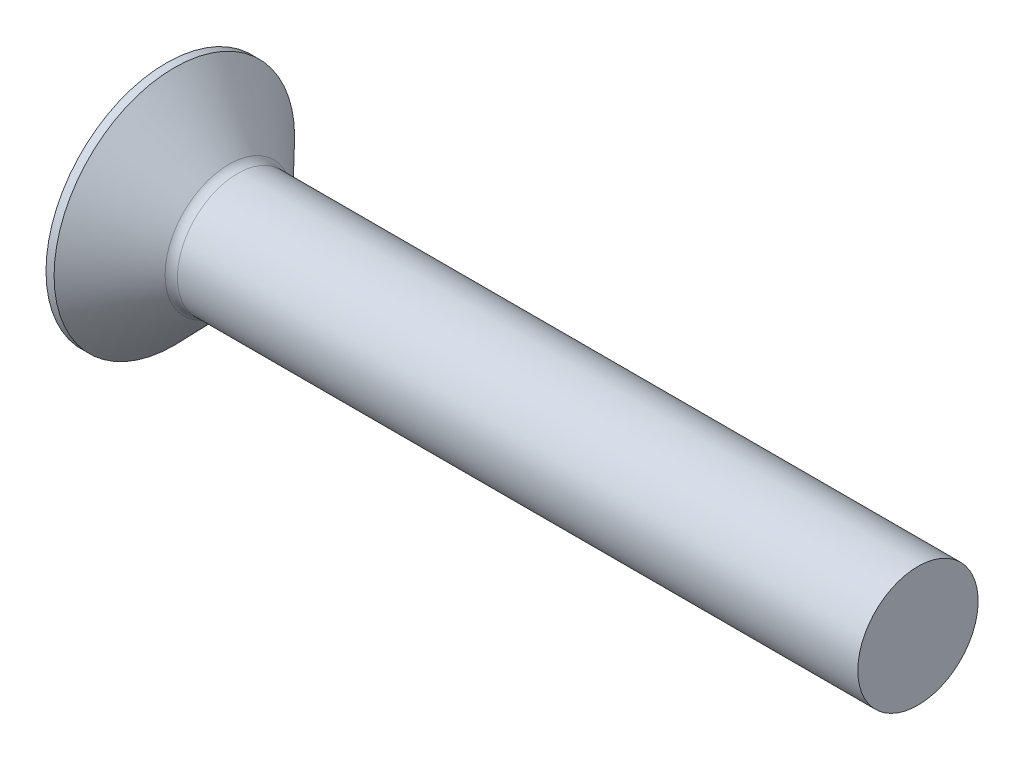
from build123d import *

# Parameters (mm, degrees)
FILLET1_R    = 0.8
RECPAT_COUNT = 2
RECPAT_ANGLE = 90


with BuildPart() as part:
    # BodySke → BaseBody (revolve)
    with BuildSketch(Plane.XY):
        with BuildLine():
            Line((1.8, 8), (2.337244901, 8))
            Line((2.337244901, 8), (6.2, 4))
            Line((6.2, 4), (51.8, 4))
            Line((51.8, 4), (51.8, 0))
            Line((51.8, 0), (1.8, 0))
            Line((1.8, 0), (0, 0))
            ThreePointArc((0, 0), (0.455555556, 4.1), (1.8, 8))
        make_face()
    revolve(axis=Axis((1.8, 0, 0), (1, 0, 0)))

    # Fillet1
    fillet1_edges = [part.edges().sort_by_distance(p)[0] for p in [
        (6.2, -4, 0),
    ]]
    fillet(fillet1_edges, radius=FILLET1_R)

    # RecSkeTop → Recess section 0
    with BuildSketch(Plane(origin=(0, 0, 0), x_dir=(0, 0, -1), z_dir=(1, 0, 0))):
        with BuildLine():
            Line((-0.946, 4.3), (0.946, 4.3))
            Line((0.946, 4.3), (0.946, -4.3))
            Line((0.946, -4.3), (-0.946, -4.3))
            Line((-0.946, -4.3), (-0.946, 4.3))
        make_face()
    # RecSkeBot → Recess section 1
    with BuildSketch(Plane(origin=(5.18, 0, 0), x_dir=(0, 0, -1), z_dir=(1, 0, 0))):
        with BuildLine():
            Line((-0.946, 1.717347702), (0.946, 1.717347702))
            Line((0.946, 1.717347702), (0.946, -1.717347702))
            Line((0.946, -1.717347702), (-0.946, -1.717347702))
            Line((-0.946, -1.717347702), (-0.946, 1.717347702))
        make_face()
    recess = loft(mode=Mode.SUBTRACT)

    # RecPat: Recess ×2 about axis
    recpat_axis = Axis((1.8, 0, 0), (1, 0, 0))
    for i in range(1, RECPAT_COUNT):
        add(recess.rotate(recpat_axis, i * RECPAT_ANGLE / (RECPAT_COUNT - 1)), mode=Mode.SUBTRACT)

    # RecCorSke → RecessCore (revolve, cut)
    with BuildSketch(Plane.XY):
        Polygon((0, 0), (0, 2.0812), (5.18, 1.718979114), (5.738530172, 0), align=None)
    revolve(axis=Axis((0, 0, 0), (1, 0, 0)), mode=Mode.SUBTRACT)


solid = part.part
